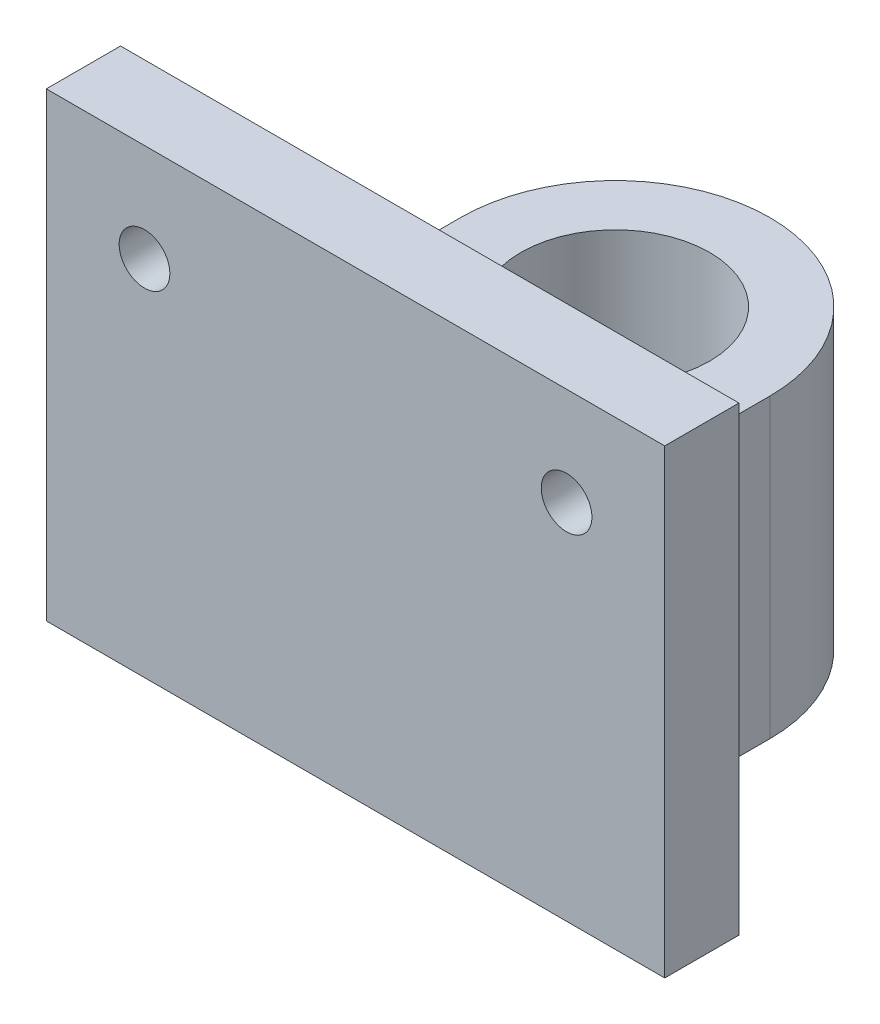
from build123d import *

# Parameters (mm, degrees)
PROFILE_SKETCH1_R                  = 7.625
PROFILE_BOSS_EXTRUDE2_DEPTH        = 37.25987
FASTENINGHOLESKETCH3_R             = 2.05
FASTENINGHOLECUT_EXTRUDE8_DEPTH    = 56.995963358
LM8UU_PLUGBOSS_EXTRUDE1_DEPTH      = 0.0001
LM8UU_PLUGBOSS_EXTRUDE1_DEPTH_BACK = 1
LM8UUPLUGSKETCH1_R                 = 7.625
LM8UUPLUGSKETCH1_R_2               = 4.5
CUT_EXTRUDE1_START                 = -13.25987
CUT_EXTRUDE1_DEPTH                 = 13.25987


with BuildPart() as part:
    # Profile-Sketch1 → Profile-Boss-Extrude2 (new body)
    with BuildSketch(Plane(origin=(0, 0, 0), x_dir=(1, 0, 0), z_dir=(0, 1, 0))):
        with BuildLine():
            Line((-25, -21), (25, -21))
            Line((25, -21), (25, -15))
            Line((25, -15), (22.5, -15))
            ThreePointArc((22.5, -15), (15.428932188, -12.071067812), (12.5, -5))
            Line((12.5, -5), (12.5, 0))
            ThreePointArc((12.5, 0), (0, 12.5), (-12.5, 0))
            Line((-12.5, 0), (-12.5, -5))
            ThreePointArc((-12.5, -5), (-15.428932188, -12.071067812), (-22.5, -15))
            Line((-22.5, -15), (-25, -15))
            Line((-25, -15), (-25, -21))
        make_face()
        Circle(PROFILE_SKETCH1_R, mode=Mode.SUBTRACT)
    extrude(amount=PROFILE_BOSS_EXTRUDE2_DEPTH)

    # FasteningHoleSketch3 → FasteningHoleCut-Extrude8 (cut, through all)
    with BuildSketch(Plane.XY.offset(21)):
        with Locations((-17.0625, 29.32237)):
            Circle(FASTENINGHOLESKETCH3_R)
        with Locations((17.0625, 29.32237)):
            Circle(FASTENINGHOLESKETCH3_R)
    extrude(amount=-FASTENINGHOLECUT_EXTRUDE8_DEPTH, mode=Mode.SUBTRACT)

    # LM8UUPlugSketch1 → LM8UU plugBoss-Extrude1 (add, two sides: drawn at the far end of the back side and taken through both)
    with BuildSketch(Plane.XZ.offset(-LM8UU_PLUGBOSS_EXTRUDE1_DEPTH_BACK)):
        Circle(LM8UUPLUGSKETCH1_R)
        Circle(LM8UUPLUGSKETCH1_R_2, mode=Mode.SUBTRACT)
    extrude(amount=LM8UU_PLUGBOSS_EXTRUDE1_DEPTH + LM8UU_PLUGBOSS_EXTRUDE1_DEPTH_BACK)

    # Sketch2 → Cut-Extrude1 (cut)
    with BuildSketch(Plane(origin=(0, 37.25987, 0), x_dir=(1, 0, 0), z_dir=(0, 1, 0)).offset(CUT_EXTRUDE1_START)):
        with BuildLine():
            Line((-12.5, 0), (-12.5, -5))
            ThreePointArc((-12.5, -5), (-15.428932188, -12.071067812), (-22.5, -15))
            Line((-22.5, -15), (22.5, -15))
            ThreePointArc((22.5, -15), (15.428932188, -12.071067812), (12.5, -5))
            Line((12.5, -5), (12.5, 0))
            ThreePointArc((12.5, 0), (0, 12.5), (-12.5, 0))
        make_face()
    extrude(amount=CUT_EXTRUDE1_DEPTH, mode=Mode.SUBTRACT)


solid = part.part
